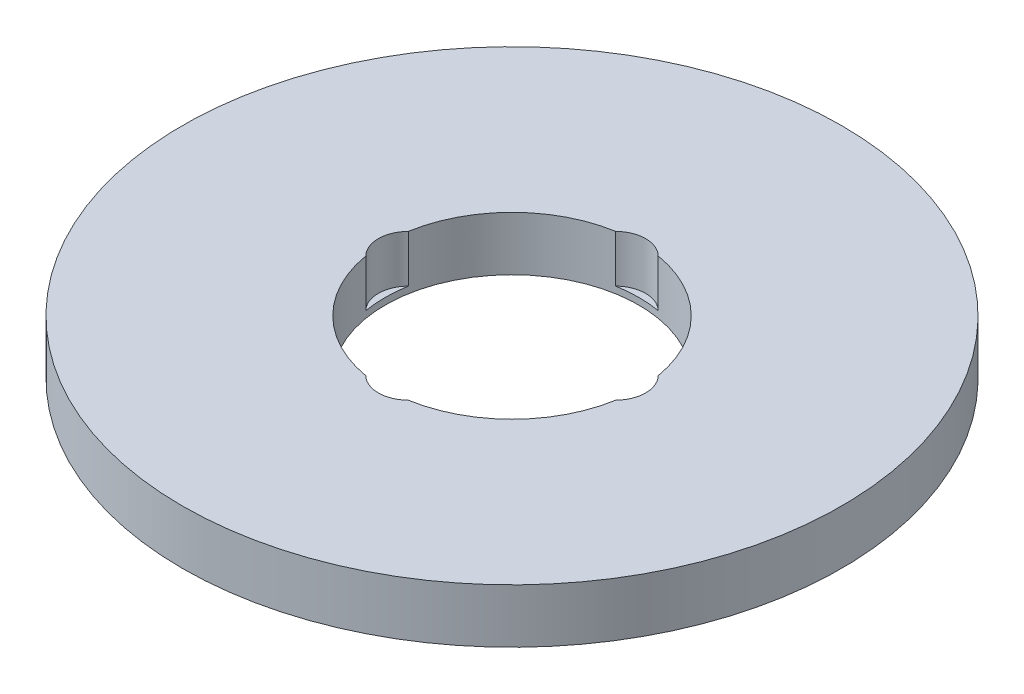
from build123d import *

# Parameters (mm, degrees)
SKETCH1_R           = 97.5
BOSS_EXTRUDE1_DEPTH = 16
SKETCH2_R           = 37.5
CUT_EXTRUDE1_DEPTH  = 139.811022617
SKETCH3_R           = 8.996956519
CUT_EXTRUDE2_DEPTH  = 14.02816458
CIRPATTERN1_COUNT   = 4


with BuildPart() as part:
    # Sketch1 → Boss-Extrude1 (new body)
    with BuildSketch(Plane(origin=(0, 0, 0), x_dir=(1, 0, 0), z_dir=(0, 1, 0))):
        Circle(SKETCH1_R)
    extrude(amount=BOSS_EXTRUDE1_DEPTH)

    # Sketch2 → Cut-Extrude1 (cut, through all)
    with BuildSketch(Plane(origin=(0, 0, 0), x_dir=(1, 0, 0), z_dir=(0, 1, 0))):
        Circle(SKETCH2_R)
    extrude(amount=CUT_EXTRUDE1_DEPTH, mode=Mode.SUBTRACT)

    # Sketch3 → Cut-Extrude2 (cut)
    with BuildSketch(Plane(origin=(0, 16, 0), x_dir=(1, 0, 0), z_dir=(0, 1, 0))):
        with Locations((-30.542458764, 0)):
            Circle(SKETCH3_R)
    cut_extrude2 = extrude(amount=-CUT_EXTRUDE2_DEPTH, mode=Mode.SUBTRACT)

    # CirPattern1: Cut-Extrude2 ×4 about axis
    cirpattern1_axis = Axis((0, 0, 0), (0, 1, 0))
    for i in range(1, CIRPATTERN1_COUNT):
        add(cut_extrude2.rotate(cirpattern1_axis, i * 360 / CIRPATTERN1_COUNT), mode=Mode.SUBTRACT)


solid = part.part
